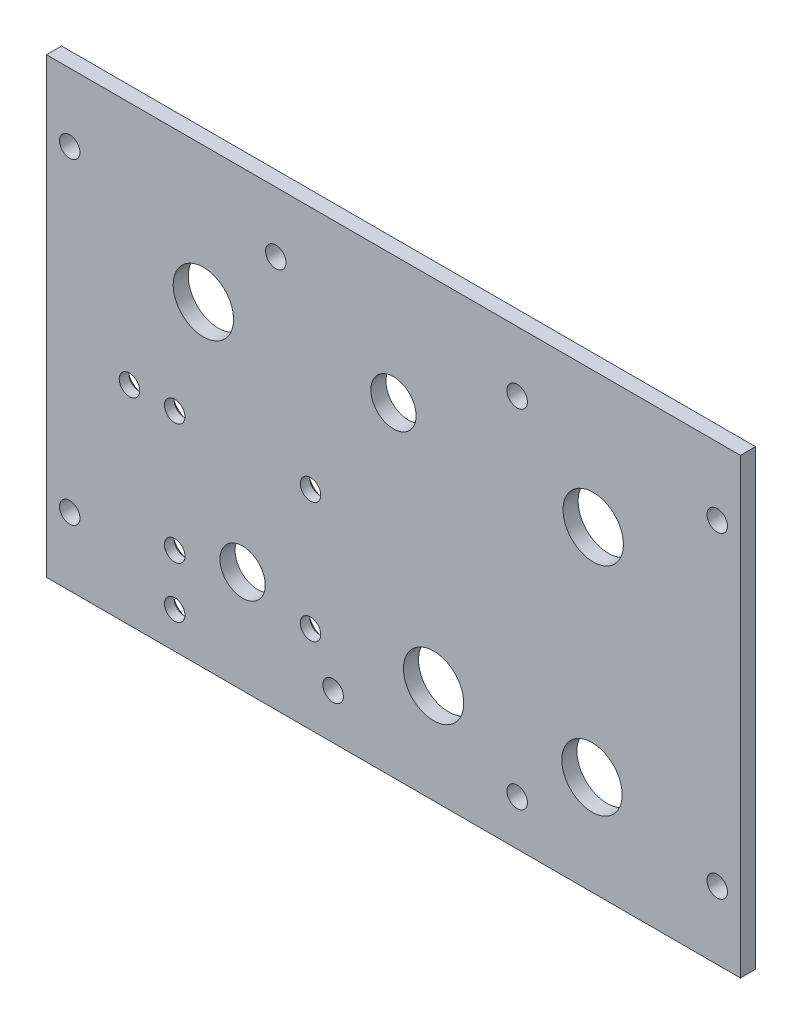
from build123d import *

# Parameters (mm, degrees)
SKETCH1_W                                         = 146.05
SKETCH1_H                                         = 95.25
BOSS_EXTRUDE1_DEPTH                               = 3.175
F_6_CLEARANCE_HOLE1_D                             = 4.3053
SKETCH5_R                                         = 6.35
SKETCH5_R_2                                       = 4.7625
CUT_EXTRUDE1_DEPTH                                = 175.524869431
CSK_FOR_6_FLAT_HEAD_MACHINE_SCREW_100_D           = 4.3053
CSK_FOR_6_FLAT_HEAD_MACHINE_SCREW_100_CSINK_D     = 7.0866
CSK_FOR_6_FLAT_HEAD_MACHINE_SCREW_100_CSINK_ANGLE = 100


with BuildPart() as part:
    # Sketch1 → Boss-Extrude1 (new body)
    with BuildSketch(Plane.XY):
        with Locations((-73.025, 47.625)):
            Rectangle(SKETCH1_W, SKETCH1_H)
    extrude(amount=-BOSS_EXTRUDE1_DEPTH)

    # #6 Clearance Hole1 (through all)
    with Locations(Plane(origin=(0, 0, -3.175), x_dir=(-1, 0, 0), z_dir=(0, 0, -1))):
        with Locations((4.8895, 80.9625), (141.1605, 80.9625), (141.1605, 14.2875), (4.8895, 14.2875), (46.99, 9.525), (85.725, 9.525), (97.79, 82.55), (46.99, 82.55)):
            Hole(F_6_CLEARANCE_HOLE1_D / 2)

    # Sketch5 → Cut-Extrude1 (cut, through all)
    with BuildSketch(Plane(origin=(0, 0, -7.4676), x_dir=(-1, 0, 0), z_dir=(0, 0, -1))):
        with Locations((30.988, 66.675)):
            Circle(SKETCH5_R)
        with Locations((113.03, 66.675)):
            Circle(SKETCH5_R)
        with Locations((64.5795, 20.955)):
            Circle(SKETCH5_R)
        with Locations((31.242, 20.955)):
            Circle(SKETCH5_R)
        with Locations((73.025, 68.326)):
            Circle(SKETCH5_R_2)
        with Locations((104.775, 21.59)):
            Circle(SKETCH5_R_2)
    extrude(amount=-CUT_EXTRUDE1_DEPTH, mode=Mode.SUBTRACT)

    # CSK for #6 Flat Head Machine Screw (100)1 (through all)
    with Locations(Plane(origin=(0, 0, -3.175), x_dir=(-1, 0, 0), z_dir=(0, 0, -1))):
        with Locations((90.4875, 43.815), (90.4875, 18.415), (119.0625, 7.636172046), (119.0625, 18.415), (119.0625, 43.815), (128.5875, 43.815)):
            CounterSinkHole(CSK_FOR_6_FLAT_HEAD_MACHINE_SCREW_100_D / 2, CSK_FOR_6_FLAT_HEAD_MACHINE_SCREW_100_CSINK_D / 2, counter_sink_angle=CSK_FOR_6_FLAT_HEAD_MACHINE_SCREW_100_CSINK_ANGLE)


solid = part.part
